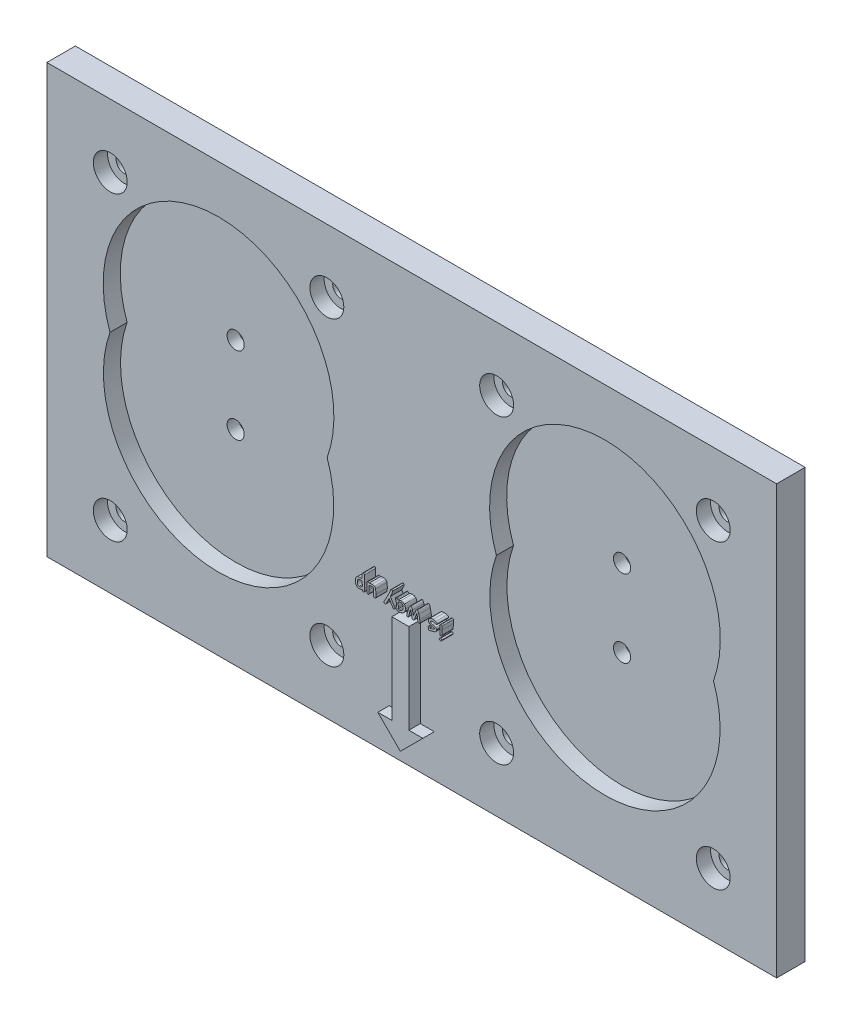
from build123d import *

# Parameters (mm, degrees)
SKETCH1_W           = 128.024549256
SKETCH1_H           = 75.085000506
BOSS_EXTRUDE1_DEPTH = 5
SKETCH7_R           = 1.4732
CUT_EXTRUDE1_DEPTH  = 10
SKETCH8_R           = 1.5
BOSS_EXTRUDE2_DEPTH = 2
BOSS_EXTRUDE3_DEPTH = 2
SKETCH10_R          = 2.9732
CUT_EXTRUDE4_DEPTH  = 2.5


with BuildPart() as part:
    # Sketch1 → Boss-Extrude1 (new body)
    with BuildSketch(Plane.XY):
        with Locations((29.392273928, 7.077500224)):
            Rectangle(SKETCH1_W, SKETCH1_H)
        with BuildLine():
            ThreePointArc((-23.546481788, 9.157693158), (-4.500101582, 36.230429762), (14.546438303, 9.157805497))
            ThreePointArc((14.546438303, 9.157805497), (-4.49994233, -17.770117418), (-23.546481788, 9.157693158))
        make_face(mode=Mode.SUBTRACT)
        with BuildLine():
            ThreePointArc((44.238109553, 9.157805497), (63.284649438, 36.230429762), (82.331029644, 9.157693158))
            ThreePointArc((82.331029644, 9.157693158), (63.284490186, -17.770117418), (44.238109553, 9.157805497))
        make_face(mode=Mode.SUBTRACT)
    extrude(amount=BOSS_EXTRUDE1_DEPTH)

    # Sketch7 → Cut-Extrude1 (cut)
    with BuildSketch(Plane.XY.offset(5)):
        with Locations((-23.500584488, 33.499560055)):
            Circle(SKETCH7_R)
        with Locations((14.49941543, 33.50027263)):
            Circle(SKETCH7_R)
        with Locations((-23.49959354, -19.345440441)):
            Circle(SKETCH7_R)
        with Locations((14.500406379, -19.344727866)):
            Circle(SKETCH7_R)
        with Locations((44.284829686, -19.345328379)):
            Circle(SKETCH7_R)
        with Locations((44.284150424, 33.499672122)):
            Circle(SKETCH7_R)
        with Locations((82.284150347, 33.500160568)):
            Circle(SKETCH7_R)
        with Locations((82.284829608, -19.344839933)):
            Circle(SKETCH7_R)
    extrude(amount=-CUT_EXTRUDE1_DEPTH, mode=Mode.SUBTRACT)

    # Sketch8 → Boss-Extrude2 (add)
    # profile 1 of 2: a face of its own
    with BuildSketch(Plane(origin=(0, 0, 0), x_dir=(-1, 0, 0), z_dir=(0, 0, -1))):
        with BuildLine():
            ThreePointArc((-44.238109553, 9.157805497), (-63.284649438, 36.230429762), (-82.331029644, 9.157693158))
            ThreePointArc((-82.331029644, 9.157693158), (-63.284490186, -17.770117418), (-44.238109553, 9.157805497))
        make_face()
        with Locations((-63.284549757, 2.429730903)):
            Circle(SKETCH8_R, mode=Mode.SUBTRACT)
        with Locations((-63.28458976, 15.994205484)):
            Circle(SKETCH8_R, mode=Mode.SUBTRACT)
    # profile 2 of 2: a face of its own
    with BuildSketch(Plane(origin=(0, 0, 0), x_dir=(-1, 0, 0), z_dir=(0, 0, -1))):
        with BuildLine():
            ThreePointArc((23.546481788, 9.157693158), (4.500101582, 36.230429762), (-14.546438303, 9.157805497))
            ThreePointArc((-14.546438303, 9.157805497), (4.49994233, -17.770117418), (23.546481788, 9.157693158))
        make_face()
        with Locations((4.500041904, 15.994205484)):
            Circle(SKETCH8_R, mode=Mode.SUBTRACT)
        with Locations((4.500001901, 2.429730903)):
            Circle(SKETCH8_R, mode=Mode.SUBTRACT)
    extrude(amount=-BOSS_EXTRUDE2_DEPTH)

    # Sketch9 → Boss-Extrude3 (add)
    # profile 1 of 9: a face of its own
    with BuildSketch(Plane.XY.offset(5)):
        Polygon((27.895948498, -7.333208146), (27.895948498, -23.075978497), (25.437954051, -23.075978497), (29.392273928, -27.030298373), (33.346593804, -23.075978497), (30.888599358, -23.075978497), (30.888599358, -7.333208146), align=None)
    # profile 2 of 9: a face of its own
    with BuildSketch(Plane.XY.offset(5)):
        with BuildLine():
            add(Edge.make_bspline(
                [(22.290429543, -4.150998376), (22.321368083, -4.151749198), (22.385044237, -4.1532945), (22.482627958, -4.163625466), (22.584765092, -4.180585447), (22.653723198, -4.196419325), (22.68919154, -4.204563421)],
                knots=[0, 0, 0, 0, 0.920669527, 1.894875937, 2.917237345, 4, 4, 4, 4], degree=3))
            Line((22.68919154, -4.204563421), (22.692663349, -3.399103864))
            add(Edge.make_bspline(
                [(22.692663349, -3.399103864), (22.693302685, -3.387123482), (22.694534628, -3.364038359), (22.704912594, -3.331090914), (22.722141057, -3.301856217), (22.745771146, -3.276522925), (22.774283563, -3.25564067), (22.8075424, -3.241235567), (22.844096444, -3.231995076), (22.869831936, -3.230991318), (22.88311684, -3.230473169)],
                knots=[0, 0, 0, 0, 1.0079105, 1.942153286, 2.878886285, 3.845202217, 4.84294963, 5.834647076, 6.882224414, 8, 8, 8, 8], degree=3))
            add(Edge.make_bspline(
                [(22.88311684, -3.230473169), (22.896401573, -3.230991411), (22.922136735, -3.231995348), (22.958693097, -3.24123458), (22.991943677, -3.255644168), (23.020486466, -3.276509925), (23.043910304, -3.301797444), (23.061572631, -3.330806409), (23.071552671, -3.363753184), (23.072887126, -3.386805652), (23.073570331, -3.398607891)],
                knots=[0, 0, 0, 0, 1.119532132, 2.168755701, 3.162011566, 4.161326904, 5.129161369, 6.055354384, 7.004394158, 8, 8, 8, 8], degree=3))
            Line((23.073570331, -3.398607891), (23.073570331, -4.071146782))
            Line((23.073570331, -4.071146782), (23.073570331, -4.742197755))
            add(Edge.make_bspline(
                [(23.073570331, -4.742197755), (23.07484487, -4.802217129), (23.077338387, -4.919639432), (23.08458194, -5.091576646), (23.093036895, -5.25530851), (23.101291774, -5.361516632), (23.10531258, -5.413248728)],
                knots=[0, 0, 0, 0, 1.072130993, 2.09752421, 3.07333771, 4, 4, 4, 4], degree=3))
            Line((23.10531258, -5.413248728), (23.137054828, -5.7544779))
            add(Edge.make_bspline(
                [(23.137054828, -5.7544779), (23.136527676, -5.773693663), (23.135512571, -5.810696248), (23.126510851, -5.863927628), (23.111344076, -5.912590544), (23.096302921, -5.941968449), (23.088945483, -5.956338762)],
                knots=[0, 0, 0, 0, 1.098354967, 2.115033068, 3.077961323, 4, 4, 4, 4], degree=3))
            add(Edge.make_bspline(
                [(23.088945483, -5.956338762), (23.079233376, -5.971291918), (23.060665055, -5.999880462), (23.022167881, -6.032602995), (22.976513435, -6.051922773), (22.943973981, -6.054307995), (22.927258404, -6.055533288)],
                knots=[0, 0, 0, 0, 1.069691436, 2.045114698, 2.995771887, 4, 4, 4, 4], degree=3))
            add(Edge.make_bspline(
                [(22.927258404, -6.055533288), (22.915622696, -6.054824526), (22.892944792, -6.053443155), (22.860157729, -6.04374964), (22.830515914, -6.02696409), (22.804477128, -6.004266138), (22.783360905, -5.977148817), (22.76770306, -5.947458669), (22.757608829, -5.915486766), (22.756640765, -5.893260192), (22.756147846, -5.881942867)],
                knots=[0, 0, 0, 0, 1.03185388, 2.011075045, 3.002631794, 4.031980664, 5.055986041, 6.033558037, 6.998727166, 8, 8, 8, 8], degree=3))
            add(Edge.make_bspline(
                [(22.756147846, -5.881942867), (22.756847957, -5.874648432), (22.758645689, -5.85591794), (22.762945836, -5.837586404), (22.765571326, -5.826393932)],
                knots=[0, 0, 0, 0, 0.778883361, 2, 2, 2, 2], degree=3))
            add(Edge.make_bspline(
                [(22.765571326, -5.826393932), (22.770343647, -5.809933259), (22.779435087, -5.778575101), (22.785167003, -5.746435782), (22.787890094, -5.731167186)],
                knots=[0, 0, 0, 0, 1.049849447, 2, 2, 2, 2], degree=3))
            add(Edge.make_bspline(
                [(22.787890094, -5.731167186), (22.761430356, -5.746823303), (22.709703052, -5.777430133), (22.631048142, -5.81766726), (22.5538276, -5.852072294), (22.477940175, -5.879930533), (22.403672609, -5.901451665), (22.331082231, -5.916832737), (22.259962412, -5.926906817), (22.212924599, -5.928017174), (22.189747099, -5.928564294)],
                knots=[0, 0, 0, 0, 1.156903695, 2.261681818, 3.323063591, 4.336832302, 5.301782854, 6.230483763, 7.128085239, 8, 8, 8, 8], degree=3))
            add(Edge.make_bspline(
                [(22.189747099, -5.928564294), (22.158779804, -5.92758412), (22.09866897, -5.925681497), (22.011473432, -5.911750007), (21.930705561, -5.888073252), (21.856404162, -5.854541774), (21.788671729, -5.811523846), (21.727770383, -5.758594624), (21.672356277, -5.69700311), (21.642518757, -5.649653475), (21.627314132, -5.625525015)],
                knots=[0, 0, 0, 0, 1.106494845, 2.147824964, 3.146158242, 4.106071706, 5.051842159, 6.002913357, 6.982323185, 8, 8, 8, 8], degree=3))
            add(Edge.make_bspline(
                [(21.627314132, -5.625525015), (21.615805942, -5.604905273), (21.592406034, -5.562978608), (21.56483776, -5.494937206), (21.54018545, -5.422855673), (21.520545325, -5.345709694), (21.505167251, -5.26370236), (21.494666969, -5.176878916), (21.48723035, -5.085374268), (21.486719662, -5.022768981), (21.486457904, -4.990680045)],
                knots=[0, 0, 0, 0, 0.860881127, 1.750452269, 2.673767605, 3.639446893, 4.652232926, 5.716238749, 6.829436428, 8, 8, 8, 8], degree=3))
            add(Edge.make_bspline(
                [(21.486457904, -4.990680045), (21.487123038, -4.961222139), (21.48842359, -4.903622355), (21.498665439, -4.819193848), (21.514777573, -4.73882534), (21.537713116, -4.662221865), (21.567387751, -4.589739932), (21.604111067, -4.521359371), (21.646353535, -4.45641975), (21.679934613, -4.417157369), (21.696750301, -4.397496775)],
                knots=[0, 0, 0, 0, 1.097325461, 2.145628071, 3.164040148, 4.148193477, 5.120535491, 6.076783161, 7.036951276, 8, 8, 8, 8], degree=3))
            add(Edge.make_bspline(
                [(21.696750301, -4.397496775), (21.715680794, -4.377878794), (21.753165639, -4.33903263), (21.816383172, -4.288761511), (21.883979598, -4.245859812), (21.956390999, -4.21093792), (22.033486445, -4.184116941), (22.115060962, -4.164801972), (22.201322471, -4.15329022), (22.260305328, -4.151773174), (22.290429543, -4.150998376)],
                knots=[0, 0, 0, 0, 0.986107724, 1.95262195, 2.915701667, 3.879394923, 4.856140219, 5.865087679, 6.909639832, 8, 8, 8, 8], degree=3))
        make_face()
        with BuildLine():
            add(Edge.make_bspline(
                [(22.167924303, -5.57939956), (22.19576595, -5.578797136), (22.250277478, -5.577617641), (22.329550362, -5.563660326), (22.405459534, -5.544368196), (22.452524827, -5.523375656), (22.475923308, -5.512939228)],
                knots=[0, 0, 0, 0, 1.050430497, 2.056651665, 3.033865591, 4, 4, 4, 4], degree=3))
            add(Edge.make_bspline(
                [(22.475923308, -5.512939228), (22.493633177, -5.503833391), (22.532076382, -5.484067149), (22.590276279, -5.44465653), (22.655970052, -5.39730622), (22.700634806, -5.360774858), (22.724405597, -5.341332696)],
                knots=[0, 0, 0, 0, 0.788993961, 1.712686639, 2.782681125, 4, 4, 4, 4], degree=3))
            add(Edge.make_bspline(
                [(22.724405597, -5.341332696), (22.719478175, -5.279190752), (22.709512533, -5.153509559), (22.699949034, -4.962489713), (22.693753374, -4.766872774), (22.693029664, -4.634907283), (22.692663349, -4.568111361)],
                knots=[0, 0, 0, 0, 0.966299621, 1.954327129, 2.964558057, 4, 4, 4, 4], degree=3))
            add(Edge.make_bspline(
                [(22.692663349, -4.568111361), (22.65941929, -4.557637111), (22.593593229, -4.536897204), (22.493005997, -4.515748982), (22.392434286, -4.503007678), (22.325349176, -4.501109208), (22.291917461, -4.50016311)],
                knots=[0, 0, 0, 0, 1.024180272, 2.027963999, 3.017240252, 4, 4, 4, 4], degree=3))
            add(Edge.make_bspline(
                [(22.291917461, -4.50016311), (22.273215088, -4.500651508), (22.236997747, -4.501597294), (22.184278819, -4.508557633), (22.135125373, -4.52050806), (22.089009595, -4.536694353), (22.0466089, -4.558443889), (22.007088322, -4.584022824), (21.971527155, -4.615247297), (21.950763609, -4.638958664), (21.940272864, -4.650938791)],
                knots=[0, 0, 0, 0, 1.132517484, 2.193131895, 3.213079003, 4.191693469, 5.145457917, 6.092418528, 7.036197851, 8, 8, 8, 8], degree=3))
            add(Edge.make_bspline(
                [(21.940272864, -4.650938791), (21.931966384, -4.662207565), (21.91534415, -4.684757693), (21.893901732, -4.721446381), (21.875494496, -4.760347356), (21.86123566, -4.802042955), (21.849817681, -4.845814264), (21.841360746, -4.892043017), (21.836325925, -4.940804467), (21.835860557, -4.974135525), (21.835622638, -4.991176017)],
                knots=[0, 0, 0, 0, 0.925462813, 1.851958798, 2.805927536, 3.76738829, 4.762045251, 5.795905863, 6.873157613, 8, 8, 8, 8], degree=3))
            add(Edge.make_bspline(
                [(21.835622638, -4.991176017), (21.835984681, -5.014985841), (21.836686521, -5.061142513), (21.839893806, -5.128023107), (21.846203783, -5.190306442), (21.85583557, -5.247835466), (21.866929401, -5.300927399), (21.880688172, -5.349459753), (21.897615724, -5.393214515), (21.91677529, -5.432544341), (21.938691835, -5.467343283), (21.963688869, -5.497178449), (21.99096855, -5.523091229), (22.021735231, -5.543143151), (22.054184497, -5.560166183), (22.08976257, -5.57143099), (22.128013788, -5.577839677), (22.154342587, -5.578868726), (22.167924303, -5.57939956)],
                knots=[0, 0, 0, 0, 1.505709777, 2.918902398, 4.232706512, 5.461535449, 6.605668957, 7.66111385, 8.647346905, 9.568371801, 10.423881033, 11.240368397, 12.024491798, 12.792846654, 13.554917462, 14.335128605, 15.141175817, 16, 16, 16, 16], degree=3))
        make_face(mode=Mode.SUBTRACT)
    # profile 3 of 9: a face of its own
    with BuildSketch(Plane.XY.offset(5)):
        with BuildLine():
            add(Edge.make_bspline(
                [(23.549704059, -5.19700466), (23.549704059, -5.174355243), (23.549704059, -5.124096683), (23.549704059, -5.041269253), (23.549704059, -4.943562644), (23.549704059, -4.835936583), (23.549704059, -4.728145197), (23.549704059, -4.630438589), (23.549704059, -4.547611159), (23.549704059, -4.497517923), (23.549704059, -4.474868506)],
                knots=[0, 0, 0, 0, 0.752747253, 1.67032967, 2.752747253, 4, 5.247252747, 6.335164835, 7.247252747, 8, 8, 8, 8], degree=3))
            add(Edge.make_bspline(
                [(23.549704059, -4.474868506), (23.549704059, -4.467924889), (23.549704059, -4.452549737), (23.549704059, -4.427089809), (23.549704059, -4.396835478), (23.549704059, -4.363274663), (23.549704059, -4.329548524), (23.549704059, -4.299128869), (23.549704059, -4.273503617), (23.549704059, -4.258128465), (23.549704059, -4.251184848)],
                knots=[0, 0, 0, 0, 0.745011086, 1.649667406, 2.731707317, 3.99113082, 5.250554324, 6.350332594, 7.254988914, 8, 8, 8, 8], degree=3))
            add(Edge.make_bspline(
                [(23.549704059, -4.251184848), (23.550366271, -4.239698894), (23.551659607, -4.217266182), (23.561957193, -4.185399398), (23.578638921, -4.156700176), (23.602478385, -4.13267189), (23.630229289, -4.112526401), (23.661808558, -4.097678102), (23.696408561, -4.089278375), (23.720439551, -4.088110562), (23.732717961, -4.087513879)],
                knots=[0, 0, 0, 0, 1.004556329, 1.961954908, 2.90344361, 3.886893461, 4.903903444, 5.895320883, 6.924633853, 8, 8, 8, 8], degree=3))
            add(Edge.make_bspline(
                [(23.732717961, -4.087513879), (23.74400528, -4.087761484), (23.765663311, -4.088236587), (23.796260308, -4.095531477), (23.823813644, -4.10654757), (23.848377222, -4.121961505), (23.869616016, -4.142212122), (23.886873005, -4.167050361), (23.901703297, -4.195833648), (23.908298204, -4.217161499), (23.911764082, -4.228370107)],
                knots=[0, 0, 0, 0, 1.089874212, 2.09124328, 3.024190006, 3.951908557, 4.879903009, 5.84335768, 6.866601288, 8, 8, 8, 8], degree=3))
            add(Edge.make_bspline(
                [(23.911764082, -4.228370107), (23.930975372, -4.219453481), (23.969646549, -4.201504846), (24.03048208, -4.180262826), (24.093074815, -4.161057309), (24.158053694, -4.145870656), (24.225103033, -4.133885267), (24.294339266, -4.125722713), (24.36564212, -4.119808997), (24.414006335, -4.119441928), (24.438487018, -4.119256128)],
                knots=[0, 0, 0, 0, 0.936654451, 1.885429331, 2.848202826, 3.833014628, 4.836106374, 5.860552156, 6.917068214, 8, 8, 8, 8], degree=3))
            add(Edge.make_bspline(
                [(24.438487018, -4.119256128), (24.458000893, -4.119550751), (24.496254904, -4.120128314), (24.55229961, -4.12438261), (24.605672245, -4.132757923), (24.65674338, -4.142571958), (24.704936397, -4.156915324), (24.75091494, -4.172989986), (24.794208195, -4.192848481), (24.821331424, -4.208642095), (24.834769152, -4.216466764)],
                knots=[0, 0, 0, 0, 1.133373759, 2.221808509, 3.260619518, 4.269946711, 5.239344102, 6.177814814, 7.097230315, 8, 8, 8, 8], degree=3))
            add(Edge.make_bspline(
                [(24.834769152, -4.216466764), (24.848698723, -4.225601516), (24.876268377, -4.243681181), (24.913443154, -4.275446775), (24.945873835, -4.310651671), (24.974504097, -4.348228032), (24.997738722, -4.389497698), (25.017349212, -4.433387708), (25.032317979, -4.480660309), (25.038463436, -4.51364005), (25.04158974, -4.530417441)],
                knots=[0, 0, 0, 0, 1.028262395, 2.035155302, 3.010693426, 3.98087141, 4.946091776, 5.929084995, 6.94648812, 8, 8, 8, 8], degree=3))
            add(Edge.make_bspline(
                [(25.04158974, -4.530417441), (25.046662005, -4.566939277), (25.056659603, -4.638925006), (25.069498052, -4.745579883), (25.080461931, -4.849245406), (25.089378188, -4.949777593), (25.096412643, -5.047329016), (25.10132805, -5.141747526), (25.104476657, -5.233189106), (25.104877289, -5.293055618), (25.105074237, -5.322485736)],
                knots=[0, 0, 0, 0, 1.112759847, 2.193285897, 3.241821804, 4.258634221, 5.239038818, 6.193310369, 7.111839193, 8, 8, 8, 8], degree=3))
            add(Edge.make_bspline(
                [(25.105074237, -5.322485736), (25.104667718, -5.362170447), (25.103827162, -5.444226112), (25.097461216, -5.571235803), (25.087663208, -5.706191376), (25.078202329, -5.798640966), (25.073331989, -5.846232837)],
                knots=[0, 0, 0, 0, 0.907149755, 1.875704132, 2.906439551, 4, 4, 4, 4], degree=3))
            add(Edge.make_bspline(
                [(25.073331989, -5.846232837), (25.070714938, -5.857746331), (25.065698028, -5.879817797), (25.052756946, -5.909964355), (25.035622551, -5.935442909), (25.014158124, -5.956319616), (24.98862927, -5.972872327), (24.958733804, -5.984310196), (24.924961169, -5.9905277), (24.901254952, -5.991525716), (24.888830169, -5.992048791)],
                knots=[0, 0, 0, 0, 1.090051886, 2.089638749, 3.013921367, 3.911135911, 4.839706395, 5.807703098, 6.850984425, 8, 8, 8, 8], degree=3))
            add(Edge.make_bspline(
                [(24.888830169, -5.992048791), (24.875393502, -5.991478833), (24.849396015, -5.990376069), (24.811918715, -5.981786029), (24.777998388, -5.96736007), (24.747910913, -5.947638567), (24.723706857, -5.922729428), (24.705021565, -5.894547512), (24.69432455, -5.862338074), (24.693067283, -5.83986051), (24.692425006, -5.828377822)],
                knots=[0, 0, 0, 0, 1.129006211, 2.184419953, 3.212005938, 4.214368323, 5.187486176, 6.112872261, 7.035958728, 8, 8, 8, 8], degree=3))
            add(Edge.make_bspline(
                [(24.692425006, -5.828377822), (24.69266168, -5.813660716), (24.693196542, -5.780401329), (24.69649997, -5.724846082), (24.70145053, -5.657882802), (24.70834358, -5.583040991), (24.715211712, -5.507368597), (24.720143786, -5.438087418), (24.723449254, -5.378727702), (24.723942266, -5.342493313), (24.724167255, -5.325957545)],
                knots=[0, 0, 0, 0, 0.701439897, 1.585193403, 2.651821012, 3.901637205, 5.167151378, 6.273071964, 7.211906636, 8, 8, 8, 8], degree=3))
            add(Edge.make_bspline(
                [(24.724167255, -5.325957545), (24.723990317, -5.281318239), (24.723648851, -5.195170196), (24.7206803, -5.070989692), (24.715842699, -4.956719857), (24.708974587, -4.852364304), (24.700248068, -4.757731104), (24.6893982, -4.672863882), (24.677038343, -4.597765218), (24.665891345, -4.551526935), (24.660682758, -4.529921468)],
                knots=[0, 0, 0, 0, 1.338632292, 2.583385881, 3.72474826, 4.768189204, 5.719317342, 6.574081987, 7.333720402, 8, 8, 8, 8], degree=3))
            add(Edge.make_bspline(
                [(24.660682758, -4.529921468), (24.640682069, -4.52073219), (24.601565612, -4.502760208), (24.5413536, -4.483589521), (24.482171518, -4.470816592), (24.442846654, -4.469207885), (24.423607839, -4.468420862)],
                knots=[0, 0, 0, 0, 1.068787749, 2.090287534, 3.06571565, 4, 4, 4, 4], degree=3))
            add(Edge.make_bspline(
                [(24.423607839, -4.468420862), (24.381581794, -4.469312707), (24.296168278, -4.471125289), (24.166429458, -4.485166816), (24.03322451, -4.507814457), (23.944212362, -4.529689518), (23.898868793, -4.540832866)],
                knots=[0, 0, 0, 0, 0.949400648, 1.929556916, 2.945298125, 4, 4, 4, 4], degree=3))
            Line((23.898868793, -4.540832866), (23.900852684, -4.881566065))
            Line((23.900852684, -4.881566065), (23.904324492, -5.207420085))
            add(Edge.make_bspline(
                [(23.904324492, -5.207420085), (23.904204663, -5.265945088), (23.903973466, -5.378862759), (23.902902968, -5.542368323), (23.901688365, -5.693813302), (23.899781616, -5.79085046), (23.898868793, -5.83730533)],
                knots=[0, 0, 0, 0, 1.114906544, 2.151091761, 3.114867005, 4, 4, 4, 4], degree=3))
            add(Edge.make_bspline(
                [(23.898868793, -5.83730533), (23.8968435, -5.849489506), (23.892976246, -5.872754932), (23.880172939, -5.904623023), (23.863278466, -5.931734677), (23.841927568, -5.954636431), (23.815087431, -5.971337996), (23.784100158, -5.983254031), (23.748786845, -5.99088704), (23.723667787, -5.991647235), (23.710399192, -5.992048791)],
                knots=[0, 0, 0, 0, 1.089531211, 2.080436699, 3.013348578, 3.902626684, 4.823199898, 5.781539455, 6.828146547, 8, 8, 8, 8], degree=3))
            add(Edge.make_bspline(
                [(23.710399192, -5.992048791), (23.69694893, -5.991533429), (23.670887028, -5.990534838), (23.633708117, -5.981214884), (23.599756505, -5.966866769), (23.570213921, -5.946533533), (23.545453634, -5.921996526), (23.528472892, -5.893246652), (23.518143614, -5.861644904), (23.518023692, -5.83970107), (23.517961811, -5.828377822)],
                knots=[0, 0, 0, 0, 1.137079376, 2.203261845, 3.225333031, 4.242695294, 5.222771604, 6.151931585, 7.046377409, 8, 8, 8, 8], degree=3))
            Line((23.517961811, -5.828377822), (23.549704059, -5.19700466))
        make_face()
    # profile 4 of 9: a face of its own
    with BuildSketch(Plane.XY.offset(5)):
        with BuildLine():
            Line((26.537939175, -5.69793702), (27.192623051, -4.451061819))
            add(Edge.make_bspline(
                [(27.192623051, -4.451061819), (27.212373675, -4.41390446), (27.250899683, -4.341424482), (27.306043918, -4.234578103), (27.357473983, -4.132247116), (27.406354796, -4.035077324), (27.450304294, -3.94182441), (27.491619848, -3.853685904), (27.529396057, -3.770125321), (27.552471381, -3.715579079), (27.563610581, -3.689247855)],
                knots=[0, 0, 0, 0, 1.191471258, 2.324110491, 3.404327343, 4.434295942, 5.403736109, 6.323094185, 7.190503659, 8, 8, 8, 8], degree=3))
            Line((27.563610581, -3.689247855), (27.688595685, -3.365873698))
            add(Edge.make_bspline(
                [(27.688595685, -3.365873698), (27.692473157, -3.355182971), (27.699859461, -3.334817908), (27.714490515, -3.30723996), (27.730807118, -3.283411029), (27.749695359, -3.264112107), (27.770405194, -3.248503509), (27.793839672, -3.23816008), (27.819156586, -3.231440271), (27.836847747, -3.230798575), (27.845819009, -3.230473169)],
                knots=[0, 0, 0, 0, 1.219021987, 2.322148857, 3.341021413, 4.307087613, 5.208427397, 6.10556674, 7.039324928, 8, 8, 8, 8], degree=3))
            add(Edge.make_bspline(
                [(27.845819009, -3.230473169), (27.85761138, -3.231026304), (27.880725679, -3.232110509), (27.914230955, -3.241261569), (27.944744486, -3.257104074), (27.97238366, -3.277738062), (27.995906961, -3.302837972), (28.01298912, -3.331959844), (28.023406669, -3.364196393), (28.024699268, -3.386627029), (28.025361103, -3.398111919)],
                knots=[0, 0, 0, 0, 1.036170122, 2.031003643, 3.026049711, 4.043997548, 5.052553558, 6.03023349, 6.99144399, 8, 8, 8, 8], degree=3))
            add(Edge.make_bspline(
                [(28.025361103, -3.398111919), (28.025858653, -3.406210347), (28.026956172, -3.424074196), (28.024762809, -3.453399634), (28.018213709, -3.487388482), (28.009361316, -3.526284639), (27.997489068, -3.570255404), (27.981183704, -3.618648198), (27.962583829, -3.67220805), (27.940030749, -3.730339603), (27.914111727, -3.793214524), (27.885424333, -3.861274215), (27.853113186, -3.934160955), (27.817398991, -4.011790877), (27.778672675, -4.094351349), (27.736452529, -4.181617973), (27.690841564, -4.273882908), (27.658895069, -4.336851779), (27.64247023, -4.369226335)],
                knots=[0, 0, 0, 0, 0.370500918, 0.817266352, 1.338941168, 1.951078848, 2.640196559, 3.419053189, 4.284021037, 5.231075865, 6.267867541, 7.391830218, 8.606134639, 9.911043596, 11.296713364, 12.773334614, 14.341055561, 16, 16, 16, 16], degree=3))
            Line((27.64247023, -4.369226335), (28.304593695, -5.527818407))
            Line((28.304593695, -5.527818407), (28.387917098, -5.650323647))
            add(Edge.make_bspline(
                [(28.387917098, -5.650323647), (28.395424664, -5.662596844), (28.409420918, -5.685477599), (28.425610314, -5.719352122), (28.436040021, -5.75039249), (28.43738511, -5.770449582), (28.438010334, -5.779772504)],
                knots=[0, 0, 0, 0, 1.227844589, 2.28905408, 3.204719432, 4, 4, 4, 4], degree=3))
            add(Edge.make_bspline(
                [(28.438010334, -5.779772504), (28.4373994, -5.791437185), (28.436184297, -5.814637377), (28.424512868, -5.848154372), (28.405858588, -5.879451584), (28.380074495, -5.906809251), (28.351022075, -5.930671652), (28.31882462, -5.947786471), (28.284737861, -5.958270789), (28.261351626, -5.959623417), (28.249540733, -5.960306543)],
                knots=[0, 0, 0, 0, 0.97058412, 1.930420343, 2.926555612, 3.991047597, 5.051149537, 6.051004055, 7.015686717, 8, 8, 8, 8], degree=3))
            add(Edge.make_bspline(
                [(28.249540733, -5.960306543), (28.236036372, -5.959653517), (28.210254429, -5.958406788), (28.173968365, -5.945740106), (28.14238855, -5.925355592), (28.126581752, -5.906063113), (28.118603958, -5.896326073)],
                knots=[0, 0, 0, 0, 1.065830189, 2.034836923, 3.008169405, 4, 4, 4, 4], degree=3))
            add(Edge.make_bspline(
                [(28.118603958, -5.896326073), (28.09185841, -5.861658988), (28.036392565, -5.789765183), (27.956240932, -5.673927499), (27.8735876, -5.548263015), (27.789901289, -5.411706151), (27.704934486, -5.264486832), (27.617940088, -5.107000875), (27.52975181, -4.938935389), (27.471808262, -4.822653163), (27.442097286, -4.763028606)],
                knots=[0, 0, 0, 0, 0.794707513, 1.648092043, 2.556222033, 3.524919023, 4.554932743, 5.641628076, 6.790727638, 8, 8, 8, 8], degree=3))
            Line((27.442097286, -4.763028606), (27.150465377, -5.336868943))
            add(Edge.make_bspline(
                [(27.150465377, -5.336868943), (27.125806132, -5.384965035), (27.078039831, -5.478129788), (27.009041485, -5.613750585), (26.944675461, -5.740610335), (26.903146488, -5.822263939), (26.883136128, -5.861607989)],
                knots=[0, 0, 0, 0, 1.101336561, 2.133348946, 3.10057108, 4, 4, 4, 4], degree=3))
            add(Edge.make_bspline(
                [(26.883136128, -5.861607989), (26.873073427, -5.876583199), (26.854065487, -5.904870624), (26.816028983, -5.936588692), (26.773319365, -5.95739564), (26.742514215, -5.959327592), (26.726904749, -5.960306543)],
                knots=[0, 0, 0, 0, 1.113286843, 2.10294332, 3.038730747, 4, 4, 4, 4], degree=3))
            add(Edge.make_bspline(
                [(26.726904749, -5.960306543), (26.7144236, -5.95985984), (26.689865817, -5.958980912), (26.654561922, -5.94819639), (26.621246204, -5.932415901), (26.591581799, -5.909956035), (26.565428405, -5.884064456), (26.547739066, -5.853377344), (26.535065872, -5.821081042), (26.534009026, -5.798245727), (26.533475422, -5.786716121)],
                knots=[0, 0, 0, 0, 1.038699064, 2.043733858, 3.056325412, 4.102793462, 5.137724282, 6.10369479, 7.042550888, 8, 8, 8, 8], degree=3))
            add(Edge.make_bspline(
                [(26.533475422, -5.786716121), (26.533644345, -5.772821009), (26.534004777, -5.743173048), (26.536574046, -5.713632694), (26.537939175, -5.69793702)],
                knots=[0, 0, 0, 0, 0.937340167, 2, 2, 2, 2], degree=3))
        make_face()
    # profile 5 of 9: a face of its own
    with BuildSketch(Plane.XY.offset(5)):
        with BuildLine():
            add(Edge.make_bspline(
                [(28.673101362, -4.087513879), (28.680353503, -4.088781192), (28.698343727, -4.091924987), (28.726135972, -4.110521061), (28.762174413, -4.135828689), (28.787088014, -4.158257012), (28.801062301, -4.170837282)],
                knots=[0, 0, 0, 0, 0.56638378, 1.405015595, 2.544447403, 4, 4, 4, 4], degree=3))
            add(Edge.make_bspline(
                [(28.801062301, -4.170837282), (28.814066447, -4.183293396), (28.83889637, -4.207076915), (28.872622864, -4.242702607), (28.901295188, -4.276251838), (28.917116774, -4.299005809), (28.924559487, -4.309709619)],
                knots=[0, 0, 0, 0, 1.1601378, 2.215149951, 3.160379649, 4, 4, 4, 4], degree=3))
            add(Edge.make_bspline(
                [(28.924559487, -4.309709619), (28.953249625, -4.294845166), (29.008466239, -4.26623726), (29.089229686, -4.227436757), (29.16462415, -4.194557522), (29.234560464, -4.167539774), (29.299323041, -4.146553498), (29.358331547, -4.130966958), (29.412111907, -4.121257657), (29.446123685, -4.119898373), (29.462193822, -4.119256128)],
                knots=[0, 0, 0, 0, 1.348931037, 2.596132651, 3.739867585, 4.78197856, 5.724904282, 6.580335045, 7.329226184, 8, 8, 8, 8], degree=3))
            add(Edge.make_bspline(
                [(29.462193822, -4.119256128), (29.497104025, -4.119872323), (29.564445918, -4.121060964), (29.661837931, -4.131562051), (29.751887354, -4.148923328), (29.835123667, -4.172123247), (29.9107875, -4.203699482), (29.978947822, -4.242031259), (30.040821774, -4.286496385), (30.075388587, -4.322539474), (30.092575039, -4.340459922)],
                knots=[0, 0, 0, 0, 1.217116685, 2.347821945, 3.410644899, 4.412405697, 5.35567366, 6.26170202, 7.135726719, 8, 8, 8, 8], degree=3))
            add(Edge.make_bspline(
                [(30.092575039, -4.340459922), (30.10755701, -4.35865337), (30.137981328, -4.395599325), (30.176381005, -4.45832759), (30.207795916, -4.528384588), (30.234131798, -4.60489725), (30.254230375, -4.688467629), (30.269129123, -4.778608775), (30.277330879, -4.875958051), (30.278470694, -4.943051924), (30.279060749, -4.977784756)],
                knots=[0, 0, 0, 0, 0.832782626, 1.691155486, 2.591170095, 3.543395435, 4.548792702, 5.627254394, 6.771688484, 8, 8, 8, 8], degree=3))
            add(Edge.make_bspline(
                [(30.279060749, -4.977784756), (30.278094434, -5.011065799), (30.276191008, -5.076622086), (30.261488404, -5.173107622), (30.237015045, -5.265801938), (30.203317892, -5.355101704), (30.159197366, -5.440503481), (30.105206672, -5.522058561), (30.041969692, -5.600153522), (29.969972623, -5.673451018), (29.891355397, -5.740209565), (29.808195582, -5.799258515), (29.720977116, -5.849063231), (29.630025756, -5.890010186), (29.534994158, -5.921179027), (29.436644675, -5.944177277), (29.33428539, -5.95780803), (29.264837436, -5.959465261), (29.229582656, -5.960306543)],
                knots=[0, 0, 0, 0, 1.00016881, 1.970111157, 2.926035868, 3.877661824, 4.833431495, 5.809339649, 6.812922877, 7.849663004, 8.89327733, 9.909516892, 10.911215618, 11.907822016, 12.902642424, 13.91287319, 14.940484346, 16, 16, 16, 16], degree=3))
            add(Edge.make_bspline(
                [(29.229582656, -5.960306543), (29.20175964, -5.959203348), (29.144147708, -5.956919009), (29.055589069, -5.942374294), (28.962256631, -5.918298282), (28.899599333, -5.896009599), (28.867026661, -5.88442273)],
                knots=[0, 0, 0, 0, 0.896895865, 1.857163955, 2.886037269, 4, 4, 4, 4], degree=3))
            add(Edge.make_bspline(
                [(28.867026661, -5.88442273), (28.847081916, -5.876579655), (28.809313848, -5.861727735), (28.757403388, -5.8367495), (28.713893902, -5.809701013), (28.677556618, -5.7822114), (28.64927048, -5.752797331), (28.628854361, -5.722177064), (28.615866142, -5.689998703), (28.614341602, -5.667795496), (28.613584646, -5.656771291)],
                knots=[0, 0, 0, 0, 1.425848779, 2.700037077, 3.826430535, 4.829815445, 5.724637067, 6.527058521, 7.268663857, 8, 8, 8, 8], degree=3))
            add(Edge.make_bspline(
                [(28.613584646, -5.656771291), (28.614069895, -5.649268084), (28.615029622, -5.634428223), (28.622554051, -5.613073181), (28.63391862, -5.592683471), (28.645028292, -5.581318378), (28.650782593, -5.575431779)],
                knots=[0, 0, 0, 0, 0.977543794, 1.933388475, 2.929589818, 4, 4, 4, 4], degree=3))
            add(Edge.make_bspline(
                [(28.650782593, -5.575431779), (28.653932801, -5.563069872), (28.661058018, -5.53510941), (28.668483869, -5.487482486), (28.674737799, -5.429544824), (28.680065351, -5.361391654), (28.684284088, -5.282665039), (28.68847702, -5.193898377), (28.6907112, -5.094678223), (28.691521824, -5.025233459), (28.691948322, -4.988696154)],
                knots=[0, 0, 0, 0, 0.51933339, 1.174640841, 1.960586495, 2.892721191, 3.958298047, 5.171478143, 6.511816293, 8, 8, 8, 8], degree=3))
            add(Edge.make_bspline(
                [(28.691948322, -4.988696154), (28.692000851, -4.955618929), (28.692100218, -4.893048288), (28.686429386, -4.804840014), (28.677990485, -4.727239259), (28.667220796, -4.679965394), (28.662189964, -4.657882408)],
                knots=[0, 0, 0, 0, 1.191592795, 2.254080368, 3.184430544, 4, 4, 4, 4], degree=3))
            add(Edge.make_bspline(
                [(28.662189964, -4.657882408), (28.660428533, -4.650923031), (28.656459829, -4.635242771), (28.648429784, -4.609619733), (28.637853006, -4.579473303), (28.625576655, -4.544646156), (28.610478399, -4.505375479), (28.593264776, -4.461338714), (28.573180334, -4.412732875), (28.559339491, -4.378657378), (28.552084039, -4.3607948)],
                knots=[0, 0, 0, 0, 0.543324072, 1.224170439, 2.031506418, 2.961691587, 4.019197454, 5.215989979, 6.540605439, 8, 8, 8, 8], degree=3))
            add(Edge.make_bspline(
                [(28.552084039, -4.3607948), (28.549774057, -4.355172368), (28.544593389, -4.342562769), (28.535955761, -4.321849377), (28.524036726, -4.298099089), (28.516147201, -4.280806461), (28.511910256, -4.271519726)],
                knots=[0, 0, 0, 0, 0.744958099, 1.67074013, 2.749107622, 4, 4, 4, 4], degree=3))
            Line((28.511910256, -4.271519726), (28.501494831, -4.242753313))
            add(Edge.make_bspline(
                [(28.501494831, -4.242753313), (28.502207969, -4.231942978), (28.503597244, -4.210883193), (28.513203067, -4.180589843), (28.530217232, -4.153972118), (28.552671531, -4.130567975), (28.579516277, -4.111885521), (28.608786484, -4.097281881), (28.640466972, -4.089474097), (28.662153178, -4.088171493), (28.673101362, -4.087513879)],
                knots=[0, 0, 0, 0, 1.009735544, 1.967081849, 2.93137993, 3.936379353, 4.977749445, 5.972489851, 6.976420567, 8, 8, 8, 8], degree=3))
        make_face()
        with BuildLine():
            add(Edge.make_bspline(
                [(29.041113056, -5.269416665), (29.040646949, -5.294898033), (29.039673342, -5.348123709), (29.030784123, -5.430800823), (29.019075843, -5.519686031), (29.006467575, -5.580294617), (28.999947327, -5.611637782)],
                knots=[0, 0, 0, 0, 0.885330041, 1.849284072, 2.887777316, 4, 4, 4, 4], degree=3))
            add(Edge.make_bspline(
                [(28.999947327, -5.611637782), (29.021181367, -5.621125747), (29.05980501, -5.638383877), (29.113560268, -5.658743116), (29.157936084, -5.671297242), (29.18472773, -5.673618935), (29.19635249, -5.674626306)],
                knots=[0, 0, 0, 0, 1.34517023, 2.446796534, 3.32607289, 4, 4, 4, 4], degree=3))
            add(Edge.make_bspline(
                [(29.19635249, -5.674626306), (29.219862728, -5.673934484), (29.266268005, -5.672568942), (29.33461993, -5.662457478), (29.400494926, -5.645614022), (29.463741463, -5.621558002), (29.524541891, -5.591132416), (29.582965598, -5.554218563), (29.638700829, -5.510241633), (29.691124817, -5.460062997), (29.739045031, -5.405659999), (29.78179928, -5.348876161), (29.817552657, -5.289659271), (29.847043115, -5.228403523), (29.869941314, -5.165086428), (29.88656137, -5.099680624), (29.895902513, -5.032115772), (29.897399999, -4.986408526), (29.898153766, -4.96340155)],
                knots=[0, 0, 0, 0, 1.019960344, 2.01323105, 2.991122735, 3.96513833, 4.943687687, 5.936854754, 6.958705619, 8.019236775, 9.081513582, 10.101675748, 11.099495889, 12.078176727, 13.047212551, 14.016381146, 15.001535314, 16, 16, 16, 16], degree=3))
            add(Edge.make_bspline(
                [(29.898153766, -4.96340155), (29.897922139, -4.940907646), (29.897471897, -4.897183663), (29.892458372, -4.8337443), (29.884233781, -4.774552969), (29.872253362, -4.719897749), (29.857604909, -4.669501783), (29.839273248, -4.623594012), (29.817319161, -4.582021832), (29.792024625, -4.544771541), (29.763641898, -4.511542974), (29.731453594, -4.483074502), (29.696092875, -4.458565662), (29.65727116, -4.438624057), (29.614955078, -4.423813913), (29.569583012, -4.413039385), (29.520788969, -4.405707531), (29.487020689, -4.405198476), (29.469633411, -4.404936365)],
                knots=[0, 0, 0, 0, 1.343449779, 2.611417491, 3.798581755, 4.910487584, 5.951025578, 6.930334951, 7.85809197, 8.753809851, 9.615054429, 10.461448849, 11.313413792, 12.179120075, 13.060015347, 13.984613139, 14.962277827, 16, 16, 16, 16], degree=3))
            add(Edge.make_bspline(
                [(29.469633411, -4.404936365), (29.441144615, -4.405440349), (29.386068149, -4.406414686), (29.307087895, -4.418445925), (29.234135921, -4.435654219), (29.190009503, -4.455038468), (29.168578023, -4.464453081)],
                knots=[0, 0, 0, 0, 1.103903528, 2.134140931, 3.093782711, 4, 4, 4, 4], degree=3))
            add(Edge.make_bspline(
                [(29.168578023, -4.464453081), (29.15623233, -4.471043357), (29.128708327, -4.485735994), (29.085764493, -4.514792451), (29.03547766, -4.550955491), (29.000479688, -4.578850846), (28.98159634, -4.593901938)],
                knots=[0, 0, 0, 0, 0.736831036, 1.642721922, 2.728117705, 4, 4, 4, 4], degree=3))
            add(Edge.make_bspline(
                [(28.98159634, -4.593901938), (28.986239633, -4.630270982), (28.99522759, -4.700670032), (29.008025561, -4.802762904), (29.017550742, -4.897908431), (29.026355995, -4.985816998), (29.032546373, -5.0667013), (29.037968296, -5.140566758), (29.040287416, -5.207404957), (29.040848903, -5.249576823), (29.041113056, -5.269416665)],
                knots=[0, 0, 0, 0, 1.296831643, 2.510258858, 3.639057327, 4.678831135, 5.635003384, 6.508243834, 7.298200213, 8, 8, 8, 8], degree=3))
        make_face(mode=Mode.SUBTRACT)
    # profile 6 of 9: a face of its own
    with BuildSketch(Plane.XY.offset(5)):
        with BuildLine():
            add(Edge.make_bspline(
                [(30.518615531, -5.721247734), (30.530227693, -5.674759105), (30.553900108, -5.57998795), (30.592375635, -5.436146906), (30.632256311, -5.287510724), (30.67580181, -5.134737623), (30.720981978, -4.977164113), (30.770193935, -4.815422643), (30.820199013, -4.648824084), (30.855730959, -4.536654765), (30.873731936, -4.479828232)],
                knots=[0, 0, 0, 0, 0.890478214, 1.815318098, 2.767079593, 3.750407651, 4.76749906, 5.813381156, 6.892228567, 8, 8, 8, 8], degree=3))
            add(Edge.make_bspline(
                [(30.873731936, -4.479828232), (30.882952469, -4.453976936), (30.901844919, -4.401008808), (30.941341504, -4.323719018), (30.987053695, -4.244438607), (31.023252362, -4.193211707), (31.041866659, -4.166869501)],
                knots=[0, 0, 0, 0, 0.922655816, 1.890479718, 2.915229735, 4, 4, 4, 4], degree=3))
            add(Edge.make_bspline(
                [(31.041866659, -4.166869501), (31.052804638, -4.153308778), (31.073960846, -4.127079669), (31.115876021, -4.09927335), (31.162836795, -4.081652339), (31.196281064, -4.080610071), (31.21347319, -4.08007429)],
                knots=[0, 0, 0, 0, 1.038068391, 2.007828726, 2.975918414, 4, 4, 4, 4], degree=3))
            add(Edge.make_bspline(
                [(31.21347319, -4.08007429), (31.229747693, -4.081784046), (31.262683598, -4.085244204), (31.30961284, -4.108628005), (31.352820534, -4.145603702), (31.392059762, -4.197056654), (31.429440786, -4.261305696), (31.462898198, -4.339872243), (31.494767314, -4.431800103), (31.511897222, -4.498524656), (31.520976223, -4.533889249)],
                knots=[0, 0, 0, 0, 0.668595789, 1.353086299, 2.115872852, 2.992126488, 4.001060733, 5.167360585, 6.498676503, 8, 8, 8, 8], degree=3))
            add(Edge.make_bspline(
                [(31.520976223, -4.533889249), (31.527407898, -4.560141564), (31.541316466, -4.616912477), (31.560332672, -4.709072123), (31.579664201, -4.814245291), (31.591566859, -4.888812667), (31.597851981, -4.928187493)],
                knots=[0, 0, 0, 0, 0.807044653, 1.745242738, 2.809389869, 4, 4, 4, 4], degree=3))
            Line((31.597851981, -4.928187493), (31.65984856, -5.303638776))
            Line((31.65984856, -5.303638776), (31.815583967, -4.981752537))
            Line((31.815583967, -4.981752537), (32.104736012, -4.286398905))
            add(Edge.make_bspline(
                [(32.104736012, -4.286398905), (32.109060019, -4.275992115), (32.117439984, -4.255823658), (32.13466295, -4.229002765), (32.153908257, -4.205422962), (32.169462728, -4.193229185), (32.177148017, -4.187204379)],
                knots=[0, 0, 0, 0, 1.083929289, 2.100665196, 3.061560182, 4, 4, 4, 4], degree=3))
            add(Edge.make_bspline(
                [(32.177148017, -4.187204379), (32.182048432, -4.179271848), (32.191697742, -4.163652057), (32.209682672, -4.143511392), (32.229549488, -4.125979125), (32.251651591, -4.111870443), (32.275932246, -4.100503145), (32.302515486, -4.09356011), (32.330845838, -4.088114421), (32.350543718, -4.087717622), (32.360657891, -4.087513879)],
                knots=[0, 0, 0, 0, 1.01682985, 2.002219675, 2.936641216, 3.903485978, 4.857083339, 5.851861963, 6.897006199, 8, 8, 8, 8], degree=3))
            add(Edge.make_bspline(
                [(32.360657891, -4.087513879), (32.366815982, -4.087728815), (32.379218698, -4.088161708), (32.397601824, -4.094112337), (32.415446194, -4.103852661), (32.433896674, -4.116895451), (32.451209021, -4.135104314), (32.469259676, -4.156519469), (32.487082509, -4.181867918), (32.504294848, -4.211396703), (32.521779701, -4.244782011), (32.538809864, -4.282337283), (32.556284486, -4.323641413), (32.573624901, -4.368972191), (32.591034502, -4.418359785), (32.607431614, -4.472023691), (32.625330994, -4.529141511), (32.635910639, -4.568893564), (32.641378401, -4.589438184)],
                knots=[0, 0, 0, 0, 0.489771272, 0.986424914, 1.523493751, 2.109391938, 2.781108719, 3.521018935, 4.344652245, 5.249748276, 6.247078125, 7.351026432, 8.539490897, 9.825865935, 11.22372013, 12.717589806, 14.30358776, 16, 16, 16, 16], degree=3))
            add(Edge.make_bspline(
                [(32.641378401, -4.589438184), (32.64724554, -4.612067084), (32.659463437, -4.65919015), (32.676870653, -4.733063116), (32.693310724, -4.812918331), (32.711022613, -4.898455984), (32.728025819, -4.989789258), (32.745765867, -5.086910689), (32.762178307, -5.189878463), (32.77346942, -5.260490001), (32.779258793, -5.296695159)],
                knots=[0, 0, 0, 0, 0.778276727, 1.62070565, 2.526405868, 3.492507911, 4.528824188, 5.619269853, 6.779311221, 8, 8, 8, 8], degree=3))
            Line((32.779258793, -5.296695159), (32.825384248, -5.54914523))
            add(Edge.make_bspline(
                [(32.825384248, -5.54914523), (32.829172862, -5.57292995), (32.836445485, -5.618587102), (32.844452643, -5.68423987), (32.849169257, -5.743992224), (32.849857354, -5.781749264), (32.85018288, -5.79961141)],
                knots=[0, 0, 0, 0, 1.146995477, 2.20177271, 3.149292506, 4, 4, 4, 4], degree=3))
            add(Edge.make_bspline(
                [(32.85018288, -5.79961141), (32.849549956, -5.810771925), (32.848310895, -5.832620603), (32.837420607, -5.863916066), (32.818913089, -5.891701726), (32.79404, -5.915745826), (32.764370253, -5.935398193), (32.731223519, -5.950065665), (32.694870424, -5.958591382), (32.669693544, -5.959724276), (32.656753553, -5.960306543)],
                knots=[0, 0, 0, 0, 0.955474673, 1.870510234, 2.802860431, 3.795814787, 4.818609809, 5.841109752, 6.890409716, 8, 8, 8, 8], degree=3))
            add(Edge.make_bspline(
                [(32.656753553, -5.960306543), (32.645147997, -5.960003928), (32.622894753, -5.959423675), (32.591417868, -5.952900584), (32.563477964, -5.942308807), (32.538647746, -5.927930998), (32.517594553, -5.908661239), (32.500064329, -5.885437225), (32.485835075, -5.858136088), (32.479842949, -5.837931323), (32.476715487, -5.827385877)],
                knots=[0, 0, 0, 0, 1.140233094, 2.18635657, 3.143775442, 4.069739672, 4.990835647, 5.930831511, 6.920041668, 8, 8, 8, 8], degree=3))
            add(Edge.make_bspline(
                [(32.476715487, -5.827385877), (32.472567357, -5.809898886), (32.46384473, -5.773127492), (32.453875305, -5.714436201), (32.444348624, -5.649954301), (32.439216535, -5.604877406), (32.436541704, -5.581383451)],
                knots=[0, 0, 0, 0, 0.864395021, 1.817637424, 2.86255856, 4, 4, 4, 4], degree=3))
            Line((32.436541704, -5.581383451), (32.407775291, -5.333893107))
            Line((32.407775291, -5.333893107), (32.294693531, -4.577534841))
            add(Edge.make_bspline(
                [(32.294693531, -4.577534841), (32.276851481, -4.621450952), (32.240530548, -4.710850667), (32.188050668, -4.848270313), (32.133592545, -4.99023657), (32.079173032, -5.13721036), (32.024822005, -5.289339036), (31.968843696, -5.445969313), (31.913787298, -5.608110738), (31.876585759, -5.717775248), (31.857741641, -5.77332486)],
                knots=[0, 0, 0, 0, 0.893420789, 1.81873037, 2.772455934, 3.75936443, 4.772618543, 5.817314929, 6.894379701, 8, 8, 8, 8], degree=3))
            add(Edge.make_bspline(
                [(31.857741641, -5.77332486), (31.852495526, -5.788032854), (31.842398369, -5.81634122), (31.821879362, -5.854514955), (31.799101383, -5.887194017), (31.773544155, -5.914303458), (31.744334708, -5.934977461), (31.712078963, -5.949296688), (31.677245186, -5.958782243), (31.652969174, -5.959789438), (31.640505627, -5.960306543)],
                knots=[0, 0, 0, 0, 1.212206438, 2.333124614, 3.356324444, 4.301429781, 5.214096403, 6.116941298, 7.033218881, 8, 8, 8, 8], degree=3))
            add(Edge.make_bspline(
                [(31.640505627, -5.960306543), (31.628543479, -5.95959126), (31.605224248, -5.958196874), (31.571577659, -5.948639645), (31.541281789, -5.931770085), (31.514159507, -5.908374008), (31.489944927, -5.878598783), (31.470201611, -5.841740361), (31.45185849, -5.799233269), (31.443213281, -5.768004658), (31.438644765, -5.751502064)],
                knots=[0, 0, 0, 0, 0.909969748, 1.773911624, 2.635285515, 3.527608137, 4.484368706, 5.53756809, 6.698740932, 8, 8, 8, 8], degree=3))
            add(Edge.make_bspline(
                [(31.438644765, -5.751502064), (31.434477697, -5.733985503), (31.4256417, -5.696842774), (31.412325417, -5.637638652), (31.397681621, -5.571958428), (31.383872055, -5.499326042), (31.367486119, -5.420468849), (31.351518249, -5.334719384), (31.333862888, -5.242388833), (31.322512437, -5.178502186), (31.316635498, -5.145423506)],
                knots=[0, 0, 0, 0, 0.698859822, 1.481886878, 2.355395367, 3.31057466, 4.351329821, 5.48148041, 6.695982518, 8, 8, 8, 8], degree=3))
            add(Edge.make_bspline(
                [(31.316635498, -5.145423506), (31.310561601, -5.111028317), (31.298758423, -5.044189417), (31.280829934, -4.946825289), (31.263556221, -4.855217854), (31.246705227, -4.769409592), (31.230366601, -4.689548965), (31.214517035, -4.615640753), (31.199160108, -4.547517737), (31.188722257, -4.504119696), (31.183714832, -4.483300041)],
                knots=[0, 0, 0, 0, 1.241034419, 2.411656378, 3.517678737, 4.553372171, 5.518796144, 6.414024125, 7.239148335, 8, 8, 8, 8], degree=3))
            Line((31.183714832, -4.483300041), (31.056745838, -4.941578754))
            Line((31.056745838, -4.941578754), (30.832070235, -5.859128126))
            add(Edge.make_bspline(
                [(30.832070235, -5.859128126), (30.829760841, -5.86720154), (30.825305721, -5.882776201), (30.813334203, -5.903257035), (30.799382314, -5.921275018), (30.781751471, -5.935766327), (30.760918546, -5.946730857), (30.737296146, -5.954577256), (30.71077501, -5.959700723), (30.692066365, -5.96009857), (30.6822865, -5.960306543)],
                knots=[0, 0, 0, 0, 1.019391005, 1.966537052, 2.869584943, 3.785354017, 4.722807581, 5.723105295, 6.809762778, 8, 8, 8, 8], degree=3))
            add(Edge.make_bspline(
                [(30.6822865, -5.960306543), (30.670485125, -5.959771638), (30.647353177, -5.958723168), (30.613903803, -5.949291848), (30.582722237, -5.93432764), (30.554957033, -5.913501529), (30.530849342, -5.889219022), (30.513779591, -5.860959211), (30.503243358, -5.830258112), (30.501926051, -5.808952655), (30.501256488, -5.798123492)],
                knots=[0, 0, 0, 0, 1.050178074, 2.058460718, 3.073614192, 4.117152069, 5.138704977, 6.104287112, 7.036444746, 8, 8, 8, 8], degree=3))
            add(Edge.make_bspline(
                [(30.501256488, -5.798123492), (30.501541232, -5.795470299), (30.50238719, -5.787587817), (30.506525878, -5.772188329), (30.51158636, -5.74913296), (30.516076477, -5.731320343), (30.518615531, -5.721247734)],
                knots=[0, 0, 0, 0, 0.405667882, 1.205216059, 2.419616485, 4, 4, 4, 4], degree=3))
        make_face()
    # profile 7 of 9: a face of its own
    with BuildSketch(Plane.XY.offset(5)):
        with BuildLine():
            add(Edge.make_bspline(
                [(34.448702677, -5.484172815), (34.463529072, -5.484771202), (34.491472575, -5.485898989), (34.529756795, -5.498560915), (34.561502147, -5.519353078), (34.575559089, -5.539188428), (34.582615288, -5.54914523)],
                knots=[0, 0, 0, 0, 1.137125184, 2.14315494, 3.067914653, 4, 4, 4, 4], degree=3))
            add(Edge.make_bspline(
                [(34.582615288, -5.54914523), (34.586991687, -5.558643256), (34.597354954, -5.581134485), (34.608205554, -5.622695863), (34.619191305, -5.676138971), (34.624705818, -5.71607409), (34.627748798, -5.738110803)],
                knots=[0, 0, 0, 0, 0.642357013, 1.521094912, 2.632108248, 4, 4, 4, 4], degree=3))
            add(Edge.make_bspline(
                [(34.627748798, -5.738110803), (34.640492368, -5.735359233), (34.667699726, -5.729484667), (34.710603617, -5.718877398), (34.758464933, -5.707127319), (34.810856448, -5.692868001), (34.868573557, -5.678360236), (34.930803078, -5.661288794), (34.998002896, -5.643054022), (35.044215223, -5.629876572), (35.068172496, -5.623045152)],
                knots=[0, 0, 0, 0, 0.687235738, 1.467239387, 2.329653946, 3.285158168, 4.329390418, 5.466790358, 6.686740069, 8, 8, 8, 8], degree=3))
            add(Edge.make_bspline(
                [(35.068172496, -5.623045152), (35.093245165, -5.614245583), (35.140606982, -5.597623355), (35.206080163, -5.569616775), (35.261464299, -5.53947161), (35.307206385, -5.507881716), (35.343293489, -5.474583142), (35.369359572, -5.439420017), (35.386120146, -5.402232428), (35.388427629, -5.376372765), (35.389562763, -5.363651465)],
                knots=[0, 0, 0, 0, 1.457955153, 2.754050925, 3.90311659, 4.912423595, 5.798073422, 6.583806749, 7.303323509, 8, 8, 8, 8], degree=3))
            add(Edge.make_bspline(
                [(35.389562763, -5.363651465), (35.370641759, -5.357974449), (35.333473014, -5.346822423), (35.295247538, -5.340146461), (35.276481002, -5.336868943)],
                knots=[0, 0, 0, 0, 1.018113715, 2, 2, 2, 2], degree=3))
            add(Edge.make_bspline(
                [(35.276481002, -5.336868943), (35.240905286, -5.331100412), (35.172075501, -5.319939802), (35.072596446, -5.300739927), (34.980430055, -5.279176599), (34.894886273, -5.257229297), (34.816357948, -5.23306914), (34.745194246, -5.206650675), (34.680500127, -5.179916456), (34.641160977, -5.158950855), (34.622293099, -5.148895315)],
                knots=[0, 0, 0, 0, 1.264819099, 2.44709689, 3.554752131, 4.586303851, 5.546109619, 6.436406756, 7.250068031, 8, 8, 8, 8], degree=3))
            add(Edge.make_bspline(
                [(34.622293099, -5.148895315), (34.597612277, -5.134084108), (34.549620231, -5.105283603), (34.485721865, -5.053820466), (34.431474282, -4.997337772), (34.386924904, -4.93599553), (34.352014292, -4.869598018), (34.327870143, -4.798114845), (34.313102809, -4.721806718), (34.31126642, -4.669357655), (34.310326313, -4.642507256)],
                knots=[0, 0, 0, 0, 1.101343464, 2.141570764, 3.131242271, 4.092496215, 5.035541149, 5.992615708, 6.972354018, 8, 8, 8, 8], degree=3))
            add(Edge.make_bspline(
                [(34.310326313, -4.642507256), (34.310988762, -4.620451503), (34.312280125, -4.577456575), (34.325273784, -4.515231889), (34.345461807, -4.456904969), (34.374686358, -4.403157102), (34.411340524, -4.353029229), (34.457018487, -4.308028577), (34.510552659, -4.266913087), (34.55057079, -4.24410163), (34.571207918, -4.232337888)],
                knots=[0, 0, 0, 0, 1.029473644, 2.006829947, 2.957433124, 3.904607518, 4.85499087, 5.849332783, 6.890912871, 8, 8, 8, 8], degree=3))
            add(Edge.make_bspline(
                [(34.571207918, -4.232337888), (34.589779715, -4.223333274), (34.627528033, -4.205030842), (34.687118948, -4.181721825), (34.750367738, -4.162535373), (34.817111235, -4.146596955), (34.887522514, -4.134380516), (34.961502418, -4.125338248), (35.039014083, -4.120619556), (35.091808385, -4.119716943), (35.118761705, -4.119256128)],
                knots=[0, 0, 0, 0, 0.877454057, 1.78347926, 2.717466389, 3.686004335, 4.699648059, 5.754765826, 6.853730152, 8, 8, 8, 8], degree=3))
            add(Edge.make_bspline(
                [(35.118761705, -4.119256128), (35.158648512, -4.120057188), (35.237841147, -4.121647642), (35.355089957, -4.136122825), (35.469902702, -4.158890184), (35.54398739, -4.182069235), (35.581008199, -4.193652023)],
                knots=[0, 0, 0, 0, 1.017525772, 2.020230577, 3.010690751, 4, 4, 4, 4], degree=3))
            add(Edge.make_bspline(
                [(35.581008199, -4.193652023), (35.603502343, -4.201483752), (35.646055704, -4.216299448), (35.703936944, -4.244023423), (35.753771515, -4.272815725), (35.79434822, -4.304994507), (35.825842215, -4.339744584), (35.849079352, -4.376580395), (35.863123623, -4.416523454), (35.864838868, -4.444178109), (35.865696491, -4.458005436)],
                knots=[0, 0, 0, 0, 1.376085787, 2.60321422, 3.704829567, 4.697553398, 5.584247208, 6.403956866, 7.201978433, 8, 8, 8, 8], degree=3))
            add(Edge.make_bspline(
                [(35.865696491, -4.458005436), (35.865124534, -4.469026302), (35.863982702, -4.491027931), (35.85166779, -4.522333615), (35.832653728, -4.551403057), (35.807174682, -4.577297094), (35.777539379, -4.599846397), (35.744117939, -4.614799036), (35.709496644, -4.62580783), (35.685416077, -4.626687837), (35.673259109, -4.627132104)],
                knots=[0, 0, 0, 0, 0.932774943, 1.862155652, 2.817216142, 3.870807191, 4.936143492, 5.960939076, 6.970589063, 8, 8, 8, 8], degree=3))
            add(Edge.make_bspline(
                [(35.673259109, -4.627132104), (35.66272079, -4.625970635), (35.63951208, -4.623412712), (35.603787044, -4.607212587), (35.564022569, -4.582722173), (35.537757952, -4.561049759), (35.523475374, -4.549264401)],
                knots=[0, 0, 0, 0, 0.737181177, 1.62350598, 2.707673527, 4, 4, 4, 4], degree=3))
            add(Edge.make_bspline(
                [(35.523475374, -4.549264401), (35.513742189, -4.542948164), (35.491065764, -4.528232563), (35.446498931, -4.513014373), (35.388883024, -4.498970019), (35.345492853, -4.491741674), (35.321614512, -4.487763794)],
                knots=[0, 0, 0, 0, 0.652538533, 1.520287786, 2.635372638, 4, 4, 4, 4], degree=3))
            add(Edge.make_bspline(
                [(35.321614512, -4.487763794), (35.301630152, -4.484789501), (35.263222939, -4.479073314), (35.207929899, -4.473488711), (35.157525748, -4.468818173), (35.125549619, -4.468548985), (35.11033017, -4.468420862)],
                knots=[0, 0, 0, 0, 1.141500804, 2.193808878, 3.14032016, 4, 4, 4, 4], degree=3))
            add(Edge.make_bspline(
                [(35.11033017, -4.468420862), (35.08485761, -4.468780822), (35.03549205, -4.469478423), (34.963743178, -4.475444293), (34.896708838, -4.485490452), (34.854176905, -4.496043772), (34.833577441, -4.501155055)],
                knots=[0, 0, 0, 0, 1.093546955, 2.119282753, 3.089113383, 4, 4, 4, 4], degree=3))
            add(Edge.make_bspline(
                [(34.833577441, -4.501155055), (34.819960081, -4.505263604), (34.794055446, -4.513079396), (34.758247004, -4.527089725), (34.728142153, -4.543550657), (34.703314225, -4.56154517), (34.683319219, -4.581251107), (34.66991695, -4.603739473), (34.660613327, -4.627412437), (34.65986581, -4.644073691), (34.659491047, -4.652426709)],
                knots=[0, 0, 0, 0, 1.374606271, 2.614946947, 3.709161729, 4.680761013, 5.573468845, 6.398387391, 7.197041403, 8, 8, 8, 8], degree=3))
            add(Edge.make_bspline(
                [(34.659491047, -4.652426709), (34.660389173, -4.670445947), (34.662156023, -4.705894514), (34.680821677, -4.756168039), (34.709553364, -4.801958346), (34.750858192, -4.841999184), (34.80254887, -4.87792113), (34.866156742, -4.908088484), (34.9402794, -4.935175127), (34.994428881, -4.94780238), (35.023038987, -4.954474042)],
                knots=[0, 0, 0, 0, 0.83881564, 1.650170272, 2.473323193, 3.347514958, 4.318548079, 5.403611645, 6.628187265, 8, 8, 8, 8], degree=3))
            Line((35.023038987, -4.954474042), (35.221924013, -4.992663935))
            add(Edge.make_bspline(
                [(35.221924013, -4.992663935), (35.242433789, -4.996746716), (35.281866647, -5.004596423), (35.338724435, -5.016752237), (35.390760757, -5.030268494), (35.438298295, -5.043954993), (35.481161808, -5.05835672), (35.519409634, -5.073202328), (35.553348404, -5.088331314), (35.573807541, -5.099815719), (35.583488062, -5.105249723)],
                knots=[0, 0, 0, 0, 1.319602244, 2.537116287, 3.66811556, 4.711320135, 5.658110905, 6.520191837, 7.299808426, 8, 8, 8, 8], degree=3))
            add(Edge.make_bspline(
                [(35.583488062, -5.105249723), (35.595794958, -5.113025493), (35.620005718, -5.12832239), (35.651551488, -5.156376989), (35.679057417, -5.186835287), (35.700760785, -5.220827998), (35.717990758, -5.257464575), (35.729731449, -5.297278457), (35.737407512, -5.339880143), (35.738281236, -5.369403202), (35.738727497, -5.384482315)],
                knots=[0, 0, 0, 0, 1.03901292, 2.043999841, 3.006757784, 3.963914654, 4.915584242, 5.891310176, 6.922971577, 8, 8, 8, 8], degree=3))
            add(Edge.make_bspline(
                [(35.738727497, -5.384482315), (35.737741753, -5.412337993), (35.735828148, -5.466413716), (35.719175423, -5.544549225), (35.690979117, -5.616184278), (35.652578347, -5.682291414), (35.602062507, -5.741151113), (35.541003831, -5.793819114), (35.468958973, -5.840235178), (35.415372025, -5.864759463), (35.387578872, -5.877479113)],
                knots=[0, 0, 0, 0, 1.033380969, 2.006083786, 2.948711423, 3.881394711, 4.830772627, 5.814107234, 6.866275202, 8, 8, 8, 8], degree=3))
            add(Edge.make_bspline(
                [(35.387578872, -5.877479113), (35.377014058, -5.881326095), (35.354659151, -5.889466223), (35.318645267, -5.901501285), (35.27812589, -5.913489857), (35.233543971, -5.927322894), (35.184214388, -5.940247861), (35.130841595, -5.955035619), (35.072625214, -5.969029521), (35.011638615, -5.984140216), (34.950766837, -5.999054647), (34.893013855, -6.013390983), (34.839937445, -6.027267236), (34.791322737, -6.040641108), (34.747301372, -6.05341022), (34.707947803, -6.065828697), (34.673282552, -6.077747015), (34.651710801, -6.085594415), (34.641636032, -6.089259427)],
                knots=[0, 0, 0, 0, 0.695576339, 1.471823765, 2.348628841, 3.30967598, 4.359225942, 5.50297508, 6.735857724, 8.063011623, 9.390165523, 10.613123095, 11.744364831, 12.784050712, 13.732387057, 14.579889251, 15.336758135, 16, 16, 16, 16], degree=3))
            add(Edge.make_bspline(
                [(34.641636032, -6.089259427), (34.629311359, -6.093788402), (34.604672777, -6.102842395), (34.565826979, -6.112411587), (34.525398714, -6.117743955), (34.497819041, -6.118590873), (34.483916734, -6.119017785)],
                knots=[0, 0, 0, 0, 0.975415483, 1.949979177, 2.966629567, 4, 4, 4, 4], degree=3))
            add(Edge.make_bspline(
                [(34.483916734, -6.119017785), (34.471793698, -6.118473408), (34.448188214, -6.117413418), (34.414533113, -6.108408171), (34.384422879, -6.093027768), (34.358176565, -6.072250973), (34.336439166, -6.046416736), (34.321843906, -6.015927233), (34.311621806, -5.98244872), (34.310769205, -5.958736728), (34.310326313, -5.946419309)],
                knots=[0, 0, 0, 0, 1.057866194, 2.05983409, 3.015778201, 3.992445116, 4.966973967, 5.935814126, 6.927739075, 8, 8, 8, 8], degree=3))
            add(Edge.make_bspline(
                [(34.310326313, -5.946419309), (34.31008993, -5.93732134), (34.30956035, -5.916938729), (34.306368352, -5.883683228), (34.301281629, -5.844502236), (34.294464138, -5.801594231), (34.287569634, -5.758530375), (34.282616278, -5.719333976), (34.27932789, -5.686088879), (34.278814905, -5.665869778), (34.278584064, -5.656771291)],
                knots=[0, 0, 0, 0, 0.748774702, 1.677515417, 2.747398367, 4.000027817, 5.252657267, 6.336036242, 7.251225298, 8, 8, 8, 8], degree=3))
            add(Edge.make_bspline(
                [(34.278584064, -5.656771291), (34.279094824, -5.644476031), (34.28007622, -5.620851395), (34.289315317, -5.587258718), (34.304448331, -5.557369117), (34.325334993, -5.531393665), (34.351324141, -5.510775668), (34.380499321, -5.49476882), (34.413629205, -5.485751096), (34.436746565, -5.484710831), (34.448702677, -5.484172815)],
                knots=[0, 0, 0, 0, 1.083858377, 2.08257174, 3.048855233, 4.024686021, 5.00051681, 5.960604696, 6.945241132, 8, 8, 8, 8], degree=3))
        make_face()
    # profile 8 of 9: a face of its own
    with BuildSketch(Plane.XY.offset(5)):
        with BuildLine():
            add(Edge.make_bspline(
                [(36.436065019, -6.341213525), (36.450666612, -6.34188163), (36.4794294, -6.34319769), (36.52103943, -6.35356183), (36.558939938, -6.372250911), (36.593262119, -6.396126705), (36.622561082, -6.424816826), (36.643877154, -6.457639915), (36.657282445, -6.493640419), (36.658587112, -6.518820891), (36.659252704, -6.531667016)],
                knots=[0, 0, 0, 0, 1.078033262, 2.123551974, 3.139483056, 4.182931503, 5.201867328, 6.1469221, 7.054629684, 8, 8, 8, 8], degree=3))
            add(Edge.make_bspline(
                [(36.659252704, -6.531667016), (36.658594611, -6.544518069), (36.657304643, -6.569708199), (36.643741378, -6.605769524), (36.622747185, -6.638976433), (36.593219594, -6.667647594), (36.559078047, -6.691697948), (36.520898428, -6.709640754), (36.479448252, -6.720175409), (36.45067296, -6.721465557), (36.436065019, -6.722120508)],
                knots=[0, 0, 0, 0, 0.944773288, 1.851907628, 2.806638966, 3.824931304, 4.867720784, 5.877789109, 6.922647547, 8, 8, 8, 8], degree=3))
            add(Edge.make_bspline(
                [(36.436065019, -6.722120508), (36.42144922, -6.721491055), (36.392818897, -6.720258044), (36.351484412, -6.709412589), (36.313246663, -6.691958412), (36.279402237, -6.667762493), (36.250811353, -6.638796406), (36.230422224, -6.605645835), (36.216788427, -6.569718548), (36.215512271, -6.544521565), (36.214861225, -6.531667016)],
                knots=[0, 0, 0, 0, 1.08199633, 2.119480662, 3.14502275, 4.182289861, 5.187787329, 6.140109812, 7.051154312, 8, 8, 8, 8], degree=3))
            add(Edge.make_bspline(
                [(36.214861225, -6.531667016), (36.215519743, -6.518817275), (36.216810546, -6.493629714), (36.23028629, -6.457765877), (36.250994187, -6.424991643), (36.279360939, -6.396013601), (36.313382101, -6.371988362), (36.351346341, -6.35379256), (36.392837299, -6.343114629), (36.421455439, -6.341856037), (36.436065019, -6.341213525)],
                knots=[0, 0, 0, 0, 0.949463081, 1.861100377, 2.803646616, 3.809798339, 4.847740377, 5.879140239, 6.917299639, 8, 8, 8, 8], degree=3))
        make_face()
    # profile 9 of 9: a face of its own
    with BuildSketch(Plane.XY.offset(5)):
        with BuildLine():
            add(Edge.make_bspline(
                [(36.341830219, -4.979272674), (36.341830219, -4.960591038), (36.341830219, -4.918929337), (36.341830219, -4.850319789), (36.341830219, -4.769310926), (36.341830219, -4.680201176), (36.341830219, -4.590926102), (36.341830219, -4.509917239), (36.341830219, -4.441307691), (36.341830219, -4.399811314), (36.341830219, -4.381129678)],
                knots=[0, 0, 0, 0, 0.749585406, 1.671641791, 2.752902156, 4, 5.247097844, 6.334991708, 7.250414594, 8, 8, 8, 8], degree=3))
            add(Edge.make_bspline(
                [(36.341830219, -4.381129678), (36.342365255, -4.369336261), (36.343399511, -4.34653893), (36.352455842, -4.313915836), (36.368296923, -4.285261099), (36.38924991, -4.260175777), (36.415263144, -4.23977776), (36.445490396, -4.224471058), (36.479943129, -4.216207765), (36.503972441, -4.215071253), (36.516412586, -4.214482873)],
                knots=[0, 0, 0, 0, 1.042943263, 2.016067381, 2.965792991, 3.921590071, 4.890853664, 5.872744842, 6.898704971, 8, 8, 8, 8], degree=3))
            add(Edge.make_bspline(
                [(36.516412586, -4.214482873), (36.528694007, -4.21504782), (36.552249658, -4.216131383), (36.586132151, -4.224657748), (36.616154495, -4.239889828), (36.642520448, -4.260165118), (36.664106008, -4.285089931), (36.679711894, -4.314020661), (36.689594878, -4.346440123), (36.690518243, -4.369318268), (36.690994953, -4.381129678)],
                knots=[0, 0, 0, 0, 1.089139987, 2.088960304, 3.073051521, 4.056048695, 5.023488166, 5.975341743, 6.954719905, 8, 8, 8, 8], degree=3))
            add(Edge.make_bspline(
                [(36.690994953, -4.381129678), (36.690994953, -4.399811314), (36.690994953, -4.441307691), (36.690994953, -4.509917239), (36.690994953, -4.590926102), (36.690994953, -4.680201176), (36.690994953, -4.769310926), (36.690994953, -4.850319789), (36.690994953, -4.918929337), (36.690994953, -4.960591038), (36.690994953, -4.979272674)],
                knots=[0, 0, 0, 0, 0.749585406, 1.665008292, 2.752902156, 4, 5.247097844, 6.328358209, 7.250414594, 8, 8, 8, 8], degree=3))
            add(Edge.make_bspline(
                [(36.690994953, -4.979272674), (36.690781661, -5.006884073), (36.690329429, -5.065427317), (36.687103507, -5.158184704), (36.682192707, -5.260698406), (36.675123842, -5.369603136), (36.668054897, -5.478507868), (36.663144311, -5.581021568), (36.659911971, -5.673944187), (36.659464443, -5.732652822), (36.659252704, -5.760429572)],
                knots=[0, 0, 0, 0, 0.847472393, 1.796858752, 2.848468188, 3.99746302, 5.146457853, 6.198067289, 7.147453648, 8, 8, 8, 8], degree=3))
            add(Edge.make_bspline(
                [(36.659252704, -5.760429572), (36.658767069, -5.772400657), (36.657826245, -5.795592323), (36.648105841, -5.828418429), (36.632205712, -5.857504009), (36.610943306, -5.882825556), (36.584532533, -5.9032865), (36.554172397, -5.917628995), (36.520613354, -5.927123305), (36.496973511, -5.928071048), (36.484670337, -5.928564294)],
                knots=[0, 0, 0, 0, 1.054999895, 2.043858484, 2.991312657, 3.965398363, 4.943852188, 5.916952365, 6.915893947, 8, 8, 8, 8], degree=3))
            add(Edge.make_bspline(
                [(36.484670337, -5.928564294), (36.472367164, -5.928071048), (36.44872732, -5.927123305), (36.415168278, -5.917628995), (36.384808141, -5.9032865), (36.358397369, -5.882825556), (36.337134963, -5.857504009), (36.321234834, -5.828418429), (36.31151443, -5.795592323), (36.310573605, -5.772400657), (36.31008797, -5.760429572)],
                knots=[0, 0, 0, 0, 1.084106053, 2.083047635, 3.056147812, 4.034601637, 5.008687343, 5.956141516, 6.945000105, 8, 8, 8, 8], degree=3))
            add(Edge.make_bspline(
                [(36.31008797, -5.760429572), (36.310299709, -5.732652822), (36.310747237, -5.673944187), (36.313979577, -5.581021568), (36.318890163, -5.478507868), (36.325959108, -5.369603136), (36.333027973, -5.260698406), (36.337938773, -5.158184704), (36.341164695, -5.065427317), (36.341616927, -5.006884073), (36.341830219, -4.979272674)],
                knots=[0, 0, 0, 0, 0.852546352, 1.801932711, 2.853542147, 4.00253698, 5.151531812, 6.203141248, 7.152527607, 8, 8, 8, 8], degree=3))
        make_face()
    extrude(amount=BOSS_EXTRUDE3_DEPTH)

    # Sketch10 → Cut-Extrude4 (cut)
    with BuildSketch(Plane.XY.offset(5)):
        with Locations((-23.500584488, 33.499560055)):
            Circle(SKETCH10_R)
        with Locations((14.49941543, 33.50027263)):
            Circle(SKETCH10_R)
        with Locations((44.284150424, 33.499672122)):
            Circle(SKETCH10_R)
        with Locations((82.284150347, 33.500160568)):
            Circle(SKETCH10_R)
        with Locations((-23.49959354, -19.345440441)):
            Circle(SKETCH10_R)
        with Locations((14.500406379, -19.344727866)):
            Circle(SKETCH10_R)
        with Locations((44.284829686, -19.345328379)):
            Circle(SKETCH10_R)
        with Locations((82.284829608, -19.344839933)):
            Circle(SKETCH10_R)
    extrude(amount=-CUT_EXTRUDE4_DEPTH, mode=Mode.SUBTRACT)


solid = part.part
